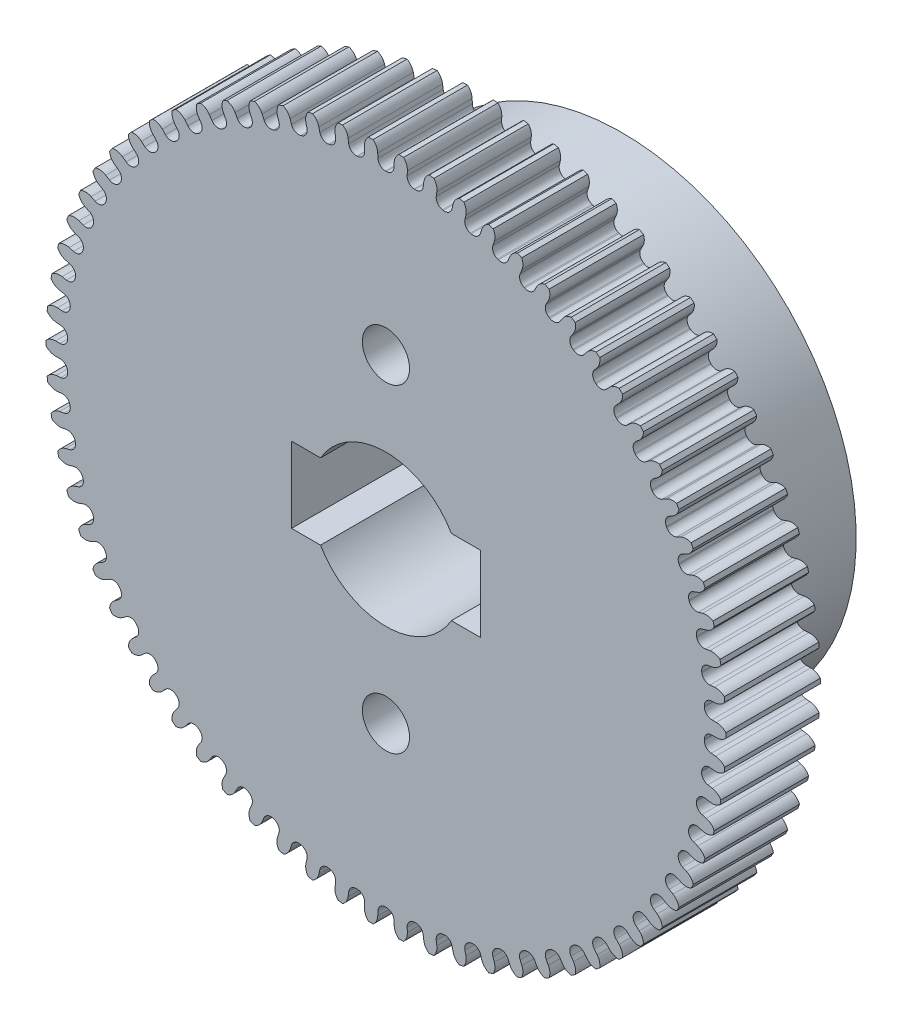
from build123d import *

# Parameters (mm, degrees)
SKETCH1_R                = 12.4
BOSS_EXTRUDE1_DEPTH      = 28
CUT_EXTRUDE1_DEPTH       = 30
SKETCH3_R                = 4.5
SKETCH3_R_2              = 3.2
BOSS_EXTRUDE2_DEPTH      = 6
CUT_EXTRUDE2_DEPTH       = 18
BOSS_EXTRUDE3_START      = 28
SKETCH5_R                = 12.4
BOSS_EXTRUDE3_DEPTH      = 28
SKETCH6_R                = 4.5
CUT_EXTRUDE3_DEPTH       = 26
CUT_EXTRUDE4_DEPTH       = 34.038159755
CUT_EXTRUDE4_DEPTH_BACK  = 34.038159755
SKETCH7_W                = 9
SKETCH7_H                = 6
CUT_EXTRUDE6_DEPTH       = 34.038159755
CUT_EXTRUDE6_DEPTH_BACK  = 34.038159755
SKETCH11_R               = 1.25
SKETCH12_R               = 4.5
SKETCH12_R_2             = 4
BOSS_EXTRUDE5_DEPTH      = 16
SKETCH13_R               = 18
SKETCH13_R_2             = 4.5
BOSS_EXTRUDE6_DEPTH      = 5
CUT_EXTRUDE7_DEPTH       = 12.5
FILLET1_R                = 0.4
CIRPATTERN1_COUNT        = 70
FILLET1_OF_CIRPATTERN1_R = 0.4
CUT_EXTRUDE8_DEPTH       = 38.835617555
CUT_EXTRUDE8_DEPTH_BACK  = 38.835617555
SKETCH16_W               = 24.8
SKETCH16_H               = 43.5
SKETCH17_W               = 10
SKETCH17_H               = 4
CUT_EXTRUDE9_DEPTH       = 29.351083855
CUT_EXTRUDE10_DEPTH      = 8.5
SKETCH20_R               = 1.25
CUT_EXTRUDE11_DEPTH      = 4


with BuildPart() as part:
    # Sketch1 → Boss-Extrude1 (new body)
    with BuildSketch(Plane.XY):
        Circle(SKETCH1_R)
    extrude(amount=BOSS_EXTRUDE1_DEPTH)

    # Sketch2 → Cut-Extrude1 (cut)
    with BuildSketch(Plane.XY.offset(28)):
        with BuildLine():
            Line((-5.968890936, -8.638422367), (-5.236121593, -7.369228634))
            Line((-5.236121593, -7.369228634), (-3.763878407, -8.219228634))
            Line((-3.763878407, -8.219228634), (-4.49664775, -9.488422367))
            ThreePointArc((-4.49664775, -9.488422367), (0, -10.5), (4.49664775, -9.488422367))
            Line((4.49664775, -9.488422367), (3.763878407, -8.219228634))
            Line((3.763878407, -8.219228634), (5.236121593, -7.369228634))
            Line((5.236121593, -7.369228634), (5.968890936, -8.638422367))
            ThreePointArc((5.968890936, -8.638422367), (9.09326674, -5.25), (10.465538687, -0.85))
            Line((10.465538687, -0.85), (9, -0.85))
            Line((9, -0.85), (9, 0.85))
            Line((9, 0.85), (10.465538687, 0.85))
            ThreePointArc((10.465538687, 0.85), (9.403628783, 4.671377282), (7, 7.826237921))
            ThreePointArc((7, 7.826237921), (0, 10.5), (-7, 7.826237921))
            ThreePointArc((-7, 7.826237921), (-9.403628783, 4.671377282), (-10.465538687, 0.85))
            Line((-10.465538687, 0.85), (-9, 0.85))
            Line((-9, 0.85), (-9, -0.85))
            Line((-9, -0.85), (-10.465538687, -0.85))
            ThreePointArc((-10.465538687, -0.85), (-9.09326674, -5.25), (-5.968890936, -8.638422367))
        make_face()
        with BuildLine():
            Line((-3.763878407, -8.219228634), (-5.236121593, -7.369228634))
            Line((-5.236121593, -7.369228634), (-5.968890936, -8.638422367))
            ThreePointArc((-5.968890936, -8.638422367), (-5.25, -9.09326674), (-4.49664775, -9.488422367))
            Line((-4.49664775, -9.488422367), (-3.763878407, -8.219228634))
        make_face()
        with BuildLine():
            Line((3.763878407, -8.219228634), (4.49664775, -9.488422367))
            ThreePointArc((4.49664775, -9.488422367), (5.25, -9.09326674), (5.968890936, -8.638422367))
            Line((5.968890936, -8.638422367), (5.236121593, -7.369228634))
            Line((5.236121593, -7.369228634), (3.763878407, -8.219228634))
        make_face()
    extrude(amount=-CUT_EXTRUDE1_DEPTH, mode=Mode.SUBTRACT)

    # Sketch2<3> → Cut-Extrude2 (cut)
    with BuildSketch(Plane.XY.offset(28)):
        with BuildLine():
            Line((-7, 10.235233266), (-7, 7.826237921))
            ThreePointArc((-7, 7.826237921), (0, 10.5), (7, 7.826237921))
            Line((7, 7.826237921), (7, 10.235233266))
            ThreePointArc((7, 10.235233266), (0, 12.4), (-7, 10.235233266))
        make_face()
    extrude(amount=-CUT_EXTRUDE2_DEPTH, mode=Mode.SUBTRACT)

    # Sketch5 → Boss-Extrude3 (add)
    with BuildSketch(Plane(origin=(0, 0, 0), x_dir=(-1, 0, 0), z_dir=(0, 0, -1)).offset(BOSS_EXTRUDE3_START)):
        Circle(SKETCH5_R)
    extrude(amount=-BOSS_EXTRUDE3_DEPTH)

    # Sketch6 → Cut-Extrude3 (cut)
    with BuildSketch(Plane(origin=(0, 0, -28), x_dir=(-1, 0, 0), z_dir=(0, 0, -1))):
        Circle(SKETCH6_R)
    extrude(amount=-CUT_EXTRUDE3_DEPTH, mode=Mode.SUBTRACT)

    # Sketch7 → Cut-Extrude4 (cut, two sides: drawn at the far end of the back side and taken through both)
    with BuildSketch(Plane(origin=(0, 0, 0), x_dir=(1, 0, 0), z_dir=(0, 1, 0)).offset(-CUT_EXTRUDE4_DEPTH_BACK)):
        with Locations((0, 5)):
            Rectangle(SKETCH7_W, SKETCH7_H)
    extrude(amount=CUT_EXTRUDE4_DEPTH + CUT_EXTRUDE4_DEPTH_BACK, mode=Mode.SUBTRACT)

    # Sketch11 → Cut-Extrude6 (cut, two sides: drawn at the far end of the back side and taken through both)
    with BuildSketch(Plane.XY.offset(-CUT_EXTRUDE6_DEPTH_BACK)):
        with Locations(Location((0, 0, 0), (0, 0, 180))):
            Circle(SKETCH11_R)
    extrude(amount=CUT_EXTRUDE6_DEPTH + CUT_EXTRUDE6_DEPTH_BACK, mode=Mode.SUBTRACT)

    # Sketch12 → Boss-Extrude5 (add)
    with BuildSketch(Plane(origin=(0, 0, -24), x_dir=(-1, 0, 0), z_dir=(0, 0, -1))):
        Circle(SKETCH12_R)
        Circle(SKETCH12_R_2, mode=Mode.SUBTRACT)
    extrude(amount=-BOSS_EXTRUDE5_DEPTH)

    # Sketch13 → Boss-Extrude6 (add)
    with BuildSketch(Plane(origin=(0, 0, -20.5), x_dir=(-1, 0, 0), z_dir=(0, 0, -1))):
        Circle(SKETCH13_R)
        Circle(SKETCH13_R_2, mode=Mode.SUBTRACT)
    extrude(amount=-BOSS_EXTRUDE6_DEPTH)

    # Sketch14 → Cut-Extrude7 (cut)
    with BuildSketch(Plane(origin=(0, 0, -28), x_dir=(-1, 0, 0), z_dir=(0, 0, -1))):
        with BuildLine():
            ThreePointArc((0.682674344, 17.987049667), (0, 18), (-0.682674344, 17.987049667))
            ThreePointArc((-0.682674344, 17.987049667), (-0.50646239, 17.767208638), (-0.435353246, 17.494583949))
            Line((-0.435353246, 17.494583949), (-0.40730691, 16.87008376))
            ThreePointArc((-0.40730691, 16.87008376), (0, 16.875), (0.40730691, 16.87008376))
            Line((0.40730691, 16.87008376), (0.435353246, 17.494583949))
            ThreePointArc((0.435353246, 17.494583949), (0.50646239, 17.767208638), (0.682674344, 17.987049667))
        make_face()
    cut_extrude7 = extrude(amount=-CUT_EXTRUDE7_DEPTH, mode=Mode.SUBTRACT)

    # Fillet1
    fillet1_edges = [part.edges().sort_by_distance(p)[0] for p in [
        (0.40730691, 16.87008376, -18),
        (-0.40730691, 16.87008376, -18),
    ]]
    fillet(fillet1_edges, radius=FILLET1_R)

    # CirPattern1: Cut-Extrude7 ×70 about axis
    cirpattern1_axis = Axis((0, 0, 0), (0, 0, 1))
    for i in range(1, CIRPATTERN1_COUNT):
        add(cut_extrude7.rotate(cirpattern1_axis, i * 360 / CIRPATTERN1_COUNT), mode=Mode.SUBTRACT)

    # Fillet1 of CirPattern1
    fillet1_of_cirpattern1_edges = [part.edges().sort_by_distance(p)[0] for p in [
        (-1.106555437, 16.838680473, -18),
        (-1.917889861, 16.765659053, -18),
        (-2.611508451, 16.671702031, -18),
        (-3.413031091, 16.526247117, -18),
        (-4.095435134, 16.370492847, -18),
        (-4.880692602, 16.153775556, -18),
        (-5.546387781, 15.937478081, -18),
        (-6.309057646, 15.651243293, -18),
        (-6.952684176, 15.376144112, -18),
        (-7.686625867, 15.022696422, -18),
        (-8.303001645, 14.691010472, -18),
        (-9.002305896, 14.273195632, -18),
        (-9.586468227, 13.887593453, -18),
        (-10.245504651, 13.408775464, -18),
        (-10.792750204, 12.972361698, -18),
        (-11.406212627, 12.43639572, -18),
        (-11.912135302, 11.952684114, -18),
        (-12.475084486, 11.36388543, -18),
        (-12.935610891, 10.836770546, -18),
        (-13.4435143, 10.199879816, -18),
        (-13.854936547, 9.633605673, -18),
        (-14.303704842, 8.953750767, -18),
        (-14.662710401, 8.352876672, -18),
        (-15.048730362, 7.635531382, -18),
        (-15.352428732, 7.004895219, -18),
        (-15.672592354, 6.255835188, -18),
        (-15.918538334, 5.600514469, -18),
        (-16.170267848, 4.825770688, -18),
        (-16.356481225, 4.151041669, -18),
        (-16.537749853, 3.356851919, -18),
        (-16.662731347, 2.668147123, -18),
        (-16.77207962, 1.860905753, -18),
        (-16.834822953, 1.163770225, -18),
        (-16.871370464, 0.349976667, -18),
        (-16.871370464, -0.349976667, -18),
        (-16.834822953, -1.163770225, -18),
        (-16.77207962, -1.860905753, -18),
        (-16.662731347, -2.668147123, -18),
        (-16.537749853, -3.356851919, -18),
        (-16.356481225, -4.151041669, -18),
        (-16.170267848, -4.825770688, -18),
        (-15.918538334, -5.600514469, -18),
        (-15.672592354, -6.255835188, -18),
        (-15.352428732, -7.004895219, -18),
        (-15.048730362, -7.635531382, -18),
        (-14.662710401, -8.352876672, -18),
        (-14.303704842, -8.953750767, -18),
        (-13.854936547, -9.633605673, -18),
        (-13.4435143, -10.199879816, -18),
        (-12.935610891, -10.836770546, -18),
        (-12.475084486, -11.36388543, -18),
        (-11.912135302, -11.952684114, -18),
        (-11.406212627, -12.43639572, -18),
        (-10.792750204, -12.972361698, -18),
        (-10.245504651, -13.408775464, -18),
        (-9.586468227, -13.887593453, -18),
        (-9.002305896, -14.273195632, -18),
        (-8.303001645, -14.691010472, -18),
        (-7.686625867, -15.022696422, -18),
        (-6.952684176, -15.376144112, -18),
        (-6.309057646, -15.651243293, -18),
        (-5.546387781, -15.937478081, -18),
        (-4.880692602, -16.153775556, -18),
        (-4.095435134, -16.370492847, -18),
        (-3.413031091, -16.526247117, -18),
        (-2.611508451, -16.671702031, -18),
        (-1.917889861, -16.765659053, -18),
        (-1.106555437, -16.838680473, -18),
        (-0.40730691, -16.87008376, -18),
        (0.40730691, -16.87008376, -18),
        (1.106555437, -16.838680473, -18),
        (1.917889861, -16.765659053, -18),
        (2.611508451, -16.671702031, -18),
        (3.413031091, -16.526247117, -18),
        (4.095435134, -16.370492847, -18),
        (4.880692602, -16.153775556, -18),
        (5.546387781, -15.937478081, -18),
        (6.309057646, -15.651243293, -18),
        (6.952684176, -15.376144112, -18),
        (7.686625867, -15.022696422, -18),
        (8.303001645, -14.691010472, -18),
        (9.002305896, -14.273195632, -18),
        (9.586468227, -13.887593453, -18),
        (10.245504651, -13.408775464, -18),
        (10.792750204, -12.972361698, -18),
        (11.406212627, -12.43639572, -18),
        (11.912135302, -11.952684114, -18),
        (12.475084486, -11.36388543, -18),
        (12.935610891, -10.836770546, -18),
        (13.4435143, -10.199879816, -18),
        (13.854936547, -9.633605673, -18),
        (14.303704842, -8.953750767, -18),
        (14.662710401, -8.352876672, -18),
        (15.048730362, -7.635531382, -18),
        (15.352428732, -7.004895219, -18),
        (15.672592354, -6.255835188, -18),
        (15.918538334, -5.600514469, -18),
        (16.170267848, -4.825770688, -18),
        (16.356481225, -4.151041669, -18),
        (16.537749853, -3.356851919, -18),
        (16.662731347, -2.668147123, -18),
        (16.77207962, -1.860905753, -18),
        (16.834822953, -1.163770225, -18),
        (16.871370464, -0.349976667, -18),
        (16.871370464, 0.349976667, -18),
        (16.834822953, 1.163770225, -18),
        (16.77207962, 1.860905753, -18),
        (16.662731347, 2.668147123, -18),
        (16.537749853, 3.356851919, -18),
        (16.356481225, 4.151041669, -18),
        (16.170267848, 4.825770688, -18),
        (15.918538334, 5.600514469, -18),
        (15.672592354, 6.255835188, -18),
        (15.352428732, 7.004895219, -18),
        (15.048730362, 7.635531382, -18),
        (14.662710401, 8.352876672, -18),
        (14.303704842, 8.953750767, -18),
        (13.854936547, 9.633605673, -18),
        (13.4435143, 10.199879816, -18),
        (12.935610891, 10.836770546, -18),
        (12.475084486, 11.36388543, -18),
        (11.912135302, 11.952684114, -18),
        (11.406212627, 12.43639572, -18),
        (10.792750204, 12.972361698, -18),
        (10.245504651, 13.408775464, -18),
        (9.586468227, 13.887593453, -18),
        (9.002305896, 14.273195632, -18),
        (8.303001645, 14.691010472, -18),
        (7.686625867, 15.022696422, -18),
        (6.952684176, 15.376144112, -18),
        (6.309057646, 15.651243293, -18),
        (5.546387781, 15.937478081, -18),
        (4.880692602, 16.153775556, -18),
        (4.095435134, 16.370492847, -18),
        (3.413031091, 16.526247117, -18),
        (2.611508451, 16.671702031, -18),
        (1.917889861, 16.765659053, -18),
        (1.106555437, 16.838680473, -18),
    ]]
    fillet(fillet1_of_cirpattern1_edges, radius=FILLET1_OF_CIRPATTERN1_R)


with BuildPart() as body_2:
    # Sketch3 → Boss-Extrude2 (new body)
    with BuildSketch(Plane.XY):
        Circle(SKETCH3_R)
        Circle(SKETCH3_R_2, mode=Mode.SUBTRACT)
    extrude(amount=BOSS_EXTRUDE2_DEPTH)


with BuildPart() as cut_extrude8_tool:
    # Sketch16 → Cut-Extrude8 (new, two sides: drawn at the far end of the back side and taken through both)
    with BuildSketch(Plane(origin=(0, 0, 0), x_dir=(1, 0, 0), z_dir=(0, 1, 0)).offset(-CUT_EXTRUDE8_DEPTH_BACK)):
        with Locations((0, -6.25)):
            Rectangle(SKETCH16_W, SKETCH16_H)
    extrude(amount=CUT_EXTRUDE8_DEPTH + CUT_EXTRUDE8_DEPTH_BACK)


with BuildPart() as part_1:
    add(part.part)

    # Cut-Extrude8: cut by cut_extrude8_tool
    add(cut_extrude8_tool.part, mode=Mode.SUBTRACT)

    # Sketch17 → Cut-Extrude9 (cut, through all)
    with BuildSketch(Plane(origin=(0, 0, -28), x_dir=(-1, 0, 0), z_dir=(0, 0, -1))):
        Rectangle(SKETCH17_W, SKETCH17_H)
    extrude(amount=-CUT_EXTRUDE9_DEPTH, mode=Mode.SUBTRACT)

    # Sketch18 → Cut-Extrude10 (cut)
    with BuildSketch(Plane(origin=(0, 0, -28), x_dir=(-1, 0, 0), z_dir=(0, 0, -1))):
        with BuildLine():
            ThreePointArc((0, 10.95), (-2.5, 8.45), (0, 5.95))
            Line((0, 5.95), (0, 10.95))
        make_face()
        with BuildLine():
            Line((0, 10.95), (0, 5.95))
            ThreePointArc((0, 5.95), (1.767766953, 6.682233047), (2.5, 8.45))
            ThreePointArc((2.5, 8.45), (1.767766953, 10.217766953), (0, 10.95))
        make_face()
        with BuildLine():
            ThreePointArc((2.5, -8.45), (1.767766953, -6.682233047), (0, -5.95))
            Line((0, -5.95), (0, -10.95))
            ThreePointArc((0, -10.95), (1.767766953, -10.217766953), (2.5, -8.45))
        make_face()
        with BuildLine():
            Line((0, -10.95), (0, -5.95))
            ThreePointArc((0, -5.95), (-2.5, -8.45), (0, -10.95))
        make_face()
    extrude(amount=-CUT_EXTRUDE10_DEPTH, mode=Mode.SUBTRACT)

    # Sketch20 → Cut-Extrude11 (cut)
    with BuildSketch(Plane(origin=(0, 0, -19.5), x_dir=(-1, 0, 0), z_dir=(0, 0, -1))):
        with Locations((0, 8.45)):
            Circle(SKETCH20_R)
        with Locations((0, -8.45)):
            Circle(SKETCH20_R)
    extrude(amount=-CUT_EXTRUDE11_DEPTH, mode=Mode.SUBTRACT)


with BuildPart() as body_2_1:
    add(body_2.part)

    # Cut-Extrude8: cut by cut_extrude8_tool
    add(cut_extrude8_tool.part, mode=Mode.SUBTRACT)


solid = part_1.part
